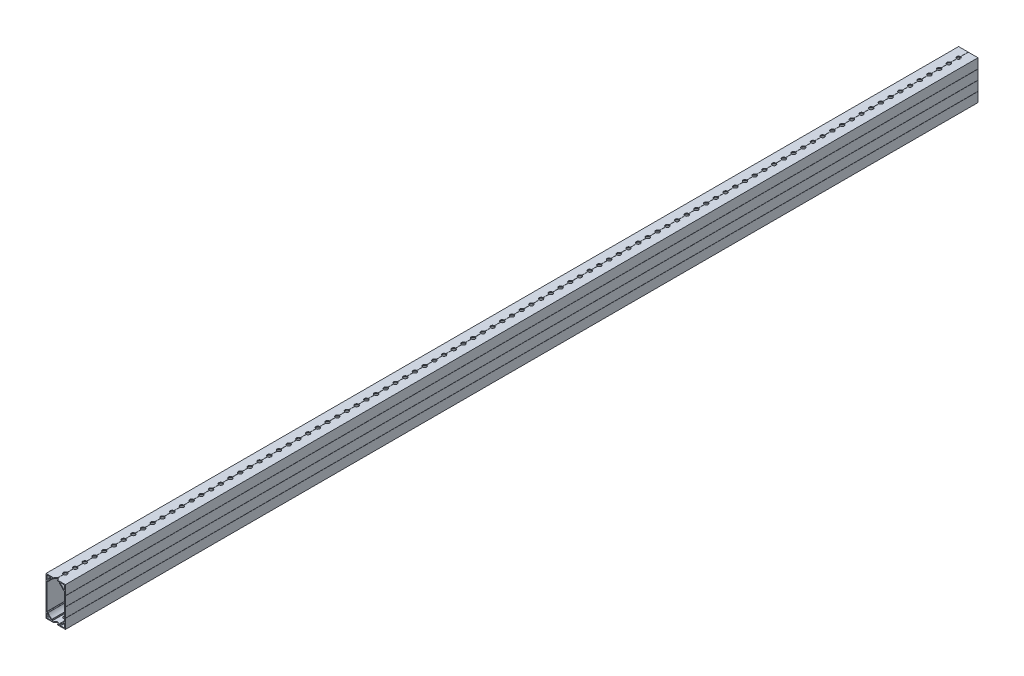
from build123d import *

# Parameters (mm, degrees)
BOSS_EXTRUDE1_DEPTH = 1193.8
SKETCH2_R           = 2.54
CUT_EXTRUDE1_DEPTH  = 1196.487636908
LPATTERN1_COUNT     = 95
LPATTERN1_PITCH     = 12.7
FILLET1_R           = 0.254


with BuildPart() as part:
    # Sketch3 → Boss-Extrude1 (new body)
    with BuildSketch(Plane.XY):
        Polygon((0.127, -25.4), (12.7, -25.4), (12.7, -12.827), (12.573, -12.7), (12.7, -12.573), (12.7, -0.127), (12.573, 0), (12.7, 0.127), (12.7, 12.573), (12.573, 12.7), (12.7, 12.827), (12.7, 25.4), (0.127, 25.4), (0, 25.273), (-0.127, 25.4), (-12.7, 25.4), (-12.7, 12.827), (-12.573, 12.7), (-12.7, 12.573), (-12.7, 0.127), (-12.573, 0), (-12.7, -0.127), (-12.7, -12.573), (-12.573, -12.7), (-12.7, -12.827), (-12.7, -25.4), (-0.127, -25.4), (0, -25.273), align=None)
        with BuildLine():
            Line((-6.597089026, -24.384), (-10.992410974, -24.384))
            ThreePointArc((-10.992410974, -24.384), (-11.481438264, -24.181438264), (-11.684, -23.692410974))
            Line((-11.684, -23.692410974), (-11.684, -19.297089026))
            ThreePointArc((-11.684, -19.297089026), (-11.177055919, -18.630604499), (-10.39941737, -18.941204261))
            ThreePointArc((-10.39941737, -18.941204261), (-8.576144596, -21.276144596), (-6.241204261, -23.09941737))
            ThreePointArc((-6.241204261, -23.09941737), (-5.930604499, -23.877055919), (-6.597089026, -24.384))
        make_face(mode=Mode.SUBTRACT)
        with BuildLine():
            ThreePointArc((10.39941737, -18.941204261), (11.177055919, -18.630604499), (11.684, -19.297089026))
            Line((11.684, -19.297089026), (11.684, -23.692410974))
            ThreePointArc((11.684, -23.692410974), (11.481438264, -24.181438264), (10.992410974, -24.384))
            Line((10.992410974, -24.384), (6.597089026, -24.384))
            ThreePointArc((6.597089026, -24.384), (5.930604499, -23.877055919), (6.241204261, -23.09941737))
            ThreePointArc((6.241204261, -23.09941737), (8.576144596, -21.276144596), (10.39941737, -18.941204261))
        make_face(mode=Mode.SUBTRACT)
        with BuildLine():
            Line((11.684, 17.5895), (11.684, 0))
            Line((11.684, 0), (11.684, -17.5895))
            Line((11.684, -17.5895), (9.979000251, -17.5895))
            ThreePointArc((9.979000251, -17.5895), (7.857724106, -20.557724106), (4.8895, -22.679000251))
            Line((4.8895, -22.679000251), (4.8895, -24.384))
            Line((4.8895, -24.384), (-4.8895, -24.384))
            Line((-4.8895, -24.384), (-4.8895, -22.679000251))
            ThreePointArc((-4.8895, -22.679000251), (-7.857724106, -20.557724106), (-9.979000251, -17.5895))
            Line((-9.979000251, -17.5895), (-11.684, -17.5895))
            Line((-11.684, -17.5895), (-11.684, 0))
            Line((-11.684, 0), (-11.684, 17.5895))
            Line((-11.684, 17.5895), (-9.979000251, 17.5895))
            ThreePointArc((-9.979000251, 17.5895), (-7.857724106, 20.557724106), (-4.8895, 22.679000251))
            Line((-4.8895, 22.679000251), (-4.8895, 24.384))
            Line((-4.8895, 24.384), (4.8895, 24.384))
            Line((4.8895, 24.384), (4.8895, 22.679000251))
            ThreePointArc((4.8895, 22.679000251), (7.857724106, 20.557724106), (9.979000251, 17.5895))
            Line((9.979000251, 17.5895), (11.684, 17.5895))
        make_face(mode=Mode.SUBTRACT)
        with BuildLine():
            ThreePointArc((-10.39941737, 18.941204261), (-11.177055919, 18.630604499), (-11.684, 19.297089026))
            Line((-11.684, 19.297089026), (-11.684, 23.692410974))
            ThreePointArc((-11.684, 23.692410974), (-11.481438264, 24.181438264), (-10.992410974, 24.384))
            Line((-10.992410974, 24.384), (-6.597089026, 24.384))
            ThreePointArc((-6.597089026, 24.384), (-5.930604499, 23.877055919), (-6.241204261, 23.09941737))
            ThreePointArc((-6.241204261, 23.09941737), (-8.576144596, 21.276144596), (-10.39941737, 18.941204261))
        make_face(mode=Mode.SUBTRACT)
        with BuildLine():
            Line((6.597089026, 24.384), (10.992410974, 24.384))
            ThreePointArc((10.992410974, 24.384), (11.481438264, 24.181438264), (11.684, 23.692410974))
            Line((11.684, 23.692410974), (11.684, 19.297089026))
            ThreePointArc((11.684, 19.297089026), (11.177055919, 18.630604499), (10.39941737, 18.941204261))
            ThreePointArc((10.39941737, 18.941204261), (8.576144596, 21.276144596), (6.241204261, 23.09941737))
            ThreePointArc((6.241204261, 23.09941737), (5.930604499, 23.877055919), (6.597089026, 24.384))
        make_face(mode=Mode.SUBTRACT)
    extrude(amount=BOSS_EXTRUDE1_DEPTH)

    # Sketch2 → Cut-Extrude1 (cut, through all)
    with BuildSketch(Plane(origin=(25.4, 25.4, 0), x_dir=(0, 0, 1), z_dir=(0, -1, 0))):
        with Locations((12.7, 25.4)):
            Circle(SKETCH2_R)
    cut_extrude1 = extrude(amount=CUT_EXTRUDE1_DEPTH, mode=Mode.SUBTRACT)

    # LPattern1: Cut-Extrude1 ×95
    with Locations(*[(0, 0, i * LPATTERN1_PITCH) for i in range(1, LPATTERN1_COUNT)]):
        add(cut_extrude1, mode=Mode.SUBTRACT)

    # Fillet1
    fillet1_edges = [part.edges().sort_by_distance(p)[0] for p in [
        (9.979000251, 17.5895, 596.9),
        (11.684, 17.5895, 596.9),
        (4.8895, 22.679000251, 596.9),
        (4.8895, 24.384, 596.9),
        (11.684, -17.5895, 596.9),
        (9.979000251, -17.5895, 596.9),
        (4.8895, -22.679000251, 596.9),
        (4.8895, -24.384, 596.9),
        (-4.8895, -22.679000251, 596.9),
        (-4.8895, -24.384, 596.9),
        (-9.979000251, -17.5895, 596.9),
        (-11.684, -17.5895, 596.9),
        (-4.8895, 24.384, 596.9),
        (-4.8895, 22.679000251, 596.9),
        (-11.684, 17.5895, 596.9),
        (-9.979000251, 17.5895, 596.9),
    ]]
    fillet(fillet1_edges, radius=FILLET1_R)


solid = part.part
